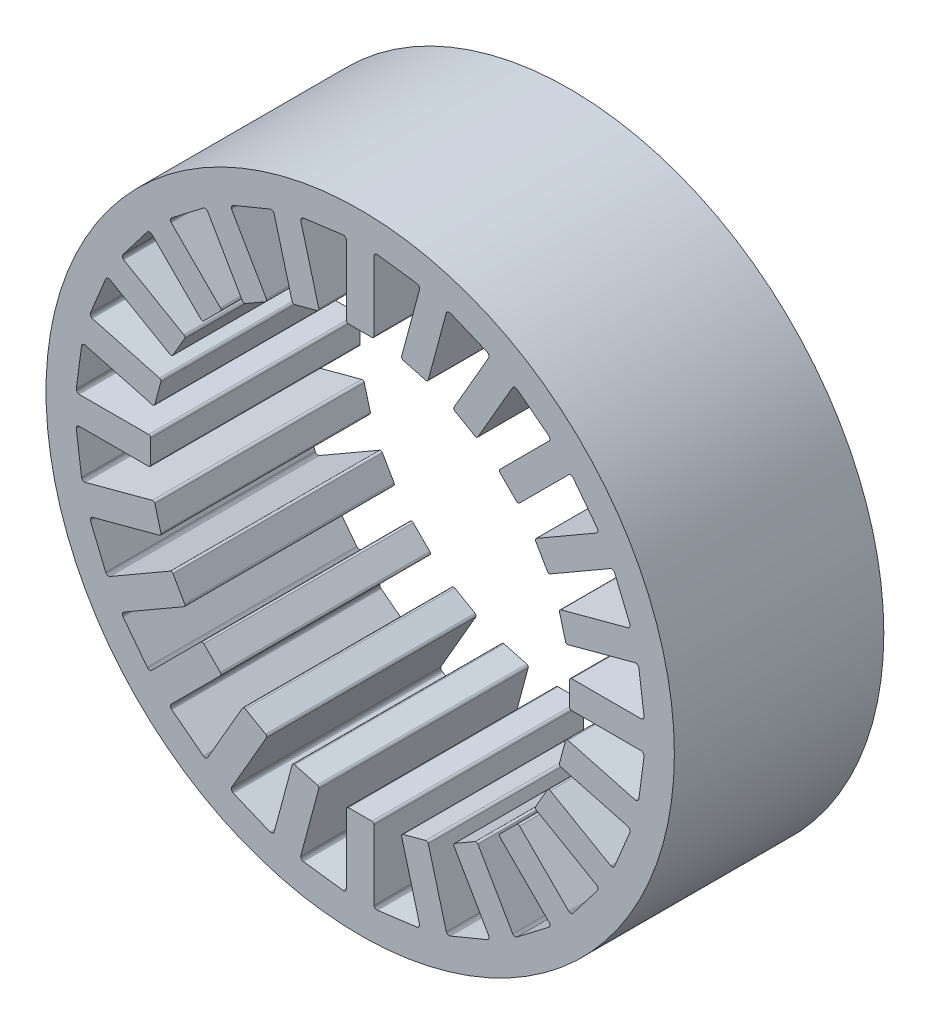
from build123d import *

# Parameters (mm, degrees)
Y_KSEKLIK_EKSTR_ZYON1_DEPTH = 100
Y_KSEKLIK_EKSTR_ZYON2_START = -100
IZIM1_R                     = 148
IZIM1_R_2                   = 145
Y_KSEKLIK_EKSTR_ZYON2_DEPTH = 100
KES_EKSTR_ZYON1_START       = -100
KES_EKSTR_ZYON1_DEPTH       = 100
DAIRESEL_KAPLAMA1_COUNT     = 6
SKETCH1_R                   = 150
SKETCH1_R_2                 = 143.530102486
BOSS_EXTRUDE4_DEPTH         = 100
SKETCH2_R                   = 103.1701
CUT_EXTRUDE1_DEPTH          = 100
BOSS_EXTRUDE8_DEPTH         = 100


with BuildPart() as part:
    # Model → Yükseklik-Ekstrüzyon1 (new body)
    with BuildSketch(Plane.XY):
        with BuildLine():
            ThreePointArc((145, 0), (123.305474643, 76.293904888), (64.713656234, 129.758015925))
            ThreePointArc((64.713656234, 129.758015925), (-123.305474643, -76.293904888), (145, 0))
        make_face()
        with BuildLine():
            Line((60.594545091, 121.498743919), (60.888526886, 121.336265924))
            Line((60.888526886, 121.336265924), (61.138983189, 121.112444487))
            Line((61.138983189, 121.112444487), (61.333355075, 120.838502951))
            Line((61.333355075, 120.838502951), (61.461895925, 120.528177888))
            Line((61.461895925, 120.528177888), (61.518160165, 120.197030291))
            Line((61.518160165, 120.197030291), (61.49932647, 119.861665286))
            Line((61.49932647, 119.861665286), (61.406339241, 119.538899472))
            Line((61.406339241, 119.538899472), (45.772590352, 92.460452083))
            Line((45.772590352, 92.460452083), (42.052500206, 92.377775575))
            Line((42.052500206, 92.377775575), (41.478475057, 90.991956276))
            ThreePointArc((41.478475057, 90.991956276), (50, 86.602540378), (58.062108146, 81.417391248))
            Line((58.062108146, 81.417391248), (58.97525029, 82.607421258))
            Line((58.97525029, 82.607421258), (57.186805174, 85.870452083))
            Line((57.186805174, 85.870452083), (72.820554063, 112.948899472))
            Line((72.820554063, 112.948899472), (73.053583842, 113.190811681))
            Line((73.053583842, 113.190811681), (73.334601609, 113.374804642))
            Line((73.334601609, 113.374804642), (73.64951596, 113.49165218))
            Line((73.64951596, 113.49165218), (73.982535773, 113.53549507))
            Line((73.982535773, 113.53549507), (74.316962046, 113.504134847))
            Line((74.316962046, 113.504134847), (74.636025247, 113.399144045))
            Line((74.636025247, 113.399144045), (74.923726217, 113.225787339))
            Line((74.923726217, 113.225787339), (89.976024918, 101.675752315))
            Line((89.976024918, 101.675752315), (90.217937127, 101.442722535))
            Line((90.217937127, 101.442722535), (90.401930088, 101.161704768))
            Line((90.401930088, 101.161704768), (90.518777625, 100.846790417))
            Line((90.518777625, 100.846790417), (90.562620515, 100.513770604))
            Line((90.562620515, 100.513770604), (90.531260293, 100.179344331))
            Line((90.531260293, 100.179344331), (90.42626949, 99.86028113))
            Line((90.42626949, 99.86028113), (90.252912785, 99.572580161))
            Line((90.252912785, 99.572580161), (68.143453075, 77.463120451))
            Line((68.143453075, 77.463120451), (64.528723672, 78.346091255))
            Line((64.528723672, 78.346091255), (63.615581528, 77.156061245))
            ThreePointArc((63.615581528, 77.156061245), (70.710678119, 70.710678119), (77.156061245, 63.615581528))
            Line((77.156061245, 63.615581528), (78.346091255, 64.528723672))
            Line((78.346091255, 64.528723672), (77.463120451, 68.143453075))
            Line((77.463120451, 68.143453075), (99.572580161, 90.252912785))
            Line((99.572580161, 90.252912785), (99.86028113, 90.42626949))
            Line((99.86028113, 90.42626949), (100.179344331, 90.531260293))
            Line((100.179344331, 90.531260293), (100.513770604, 90.562620515))
            Line((100.513770604, 90.562620515), (100.846790417, 90.518777625))
            Line((100.846790417, 90.518777625), (101.161704768, 90.401930088))
            Line((101.161704768, 90.401930088), (101.442722535, 90.217937127))
            Line((101.442722535, 90.217937127), (101.675752315, 89.976024918))
            Line((101.675752315, 89.976024918), (113.225787339, 74.923726217))
            Line((113.225787339, 74.923726217), (113.399144045, 74.636025247))
            Line((113.399144045, 74.636025247), (113.504134847, 74.316962046))
            Line((113.504134847, 74.316962046), (113.53549507, 73.982535773))
            Line((113.53549507, 73.982535773), (113.49165218, 73.64951596))
            Line((113.49165218, 73.64951596), (113.374804642, 73.334601609))
            Line((113.374804642, 73.334601609), (113.190811681, 73.053583842))
            Line((113.190811681, 73.053583842), (112.948899472, 72.820554063))
            Line((112.948899472, 72.820554063), (85.870452083, 57.186805174))
            Line((85.870452083, 57.186805174), (82.607421258, 58.97525029))
            Line((82.607421258, 58.97525029), (81.417391248, 58.062108146))
            ThreePointArc((81.417391248, 58.062108146), (86.602540378, 50), (90.991956276, 41.478475057))
            Line((90.991956276, 41.478475057), (92.377775575, 42.052500206))
            Line((92.377775575, 42.052500206), (92.460452083, 45.772590352))
            Line((92.460452083, 45.772590352), (119.538899472, 61.406339241))
            Line((119.538899472, 61.406339241), (119.861665286, 61.49932647))
            Line((119.861665286, 61.49932647), (120.197030291, 61.518160165))
            Line((120.197030291, 61.518160165), (120.528177888, 61.461895925))
            Line((120.528177888, 61.461895925), (120.838502951, 61.333355075))
            Line((120.838502951, 61.333355075), (121.112444487, 61.138983189))
            Line((121.112444487, 61.138983189), (121.336265924, 60.888526886))
            Line((121.336265924, 60.888526886), (121.498743919, 60.594545091))
            Line((121.498743919, 60.594545091), (128.759399467, 43.065771994))
            Line((128.759399467, 43.065771994), (128.852386696, 42.743006181))
            Line((128.852386696, 42.743006181), (128.871220391, 42.407641175))
            Line((128.871220391, 42.407641175), (128.814956152, 42.076493579))
            Line((128.814956152, 42.076493579), (128.686415302, 41.766168515))
            Line((128.686415302, 41.766168515), (128.492043416, 41.492226979))
            Line((128.492043416, 41.492226979), (128.241587113, 41.268405542))
            Line((128.241587113, 41.268405542), (127.947605317, 41.105927547))
            Line((127.947605317, 41.105927547), (97.74552169, 33.01330363))
            Line((97.74552169, 33.01330363), (95.056559601, 35.585343478))
            Line((95.056559601, 35.585343478), (93.670740302, 35.01131833))
            ThreePointArc((93.670740302, 35.01131833), (96.592582629, 25.88190451), (98.626899858, 16.514679058))
            Line((98.626899858, 16.514679058), (100.11406715, 16.710468346))
            Line((100.11406715, 16.710468346), (101.156756704, 20.282401239))
            Line((101.156756704, 20.282401239), (131.358840332, 28.375025157))
            Line((131.358840332, 28.375025157), (131.694675033, 28.381305983))
            Line((131.694675033, 28.381305983), (132.023487272, 28.312699085))
            Line((132.023487272, 28.312699085), (132.328789031, 28.172644698))
            Line((132.328789031, 28.172644698), (132.595271204, 27.968165734))
            Line((132.595271204, 27.968165734), (132.809571263, 27.709515623))
            Line((132.809571263, 27.709515623), (132.960943308, 27.409664161))
            Line((132.960943308, 27.409664161), (133.041796912, 27.083647153))
            Line((133.041796912, 27.083647153), (135.518271307, 8.27295658))
            Line((135.518271307, 8.27295658), (135.524552134, 7.937121879))
            Line((135.524552134, 7.937121879), (135.455945235, 7.60830964))
            Line((135.455945235, 7.60830964), (135.315890848, 7.303007881))
            Line((135.315890848, 7.303007881), (135.111411885, 7.036525708))
            Line((135.111411885, 7.036525708), (134.852761774, 6.822225649))
            Line((134.852761774, 6.822225649), (134.552910312, 6.670853604))
            Line((134.552910312, 6.670853604), (134.226893304, 6.59))
            Line((134.226893304, 6.59), (102.959395526, 6.59))
            Line((102.959395526, 6.59), (101.027750496, 9.770354316))
            Line((101.027750496, 9.770354316), (99.540583204, 9.574565028))
            ThreePointArc((99.540583204, 9.574565028), (100, 0), (99.540583204, -9.574565028))
            Line((99.540583204, -9.574565028), (101.027750496, -9.770354316))
            Line((101.027750496, -9.770354316), (102.959395526, -6.59))
            Line((102.959395526, -6.59), (134.226893304, -6.59))
            Line((134.226893304, -6.59), (134.552910312, -6.670853604))
            Line((134.552910312, -6.670853604), (134.852761774, -6.822225649))
            Line((134.852761774, -6.822225649), (135.111411885, -7.036525708))
            Line((135.111411885, -7.036525708), (135.315890848, -7.303007881))
            Line((135.315890848, -7.303007881), (135.455945235, -7.60830964))
            Line((135.455945235, -7.60830964), (135.524552134, -7.937121879))
            Line((135.524552134, -7.937121879), (135.518271307, -8.27295658))
            Line((135.518271307, -8.27295658), (133.041796912, -27.083647153))
            Line((133.041796912, -27.083647153), (132.960943308, -27.409664161))
            Line((132.960943308, -27.409664161), (132.809571263, -27.709515623))
            Line((132.809571263, -27.709515623), (132.595271204, -27.968165734))
            Line((132.595271204, -27.968165734), (132.328789031, -28.172644698))
            Line((132.328789031, -28.172644698), (132.023487272, -28.312699085))
            Line((132.023487272, -28.312699085), (131.694675033, -28.381305983))
            Line((131.694675033, -28.381305983), (131.358840332, -28.375025157))
            Line((131.358840332, -28.375025157), (101.156756704, -20.282401239))
            Line((101.156756704, -20.282401239), (100.11406715, -16.710468346))
            Line((100.11406715, -16.710468346), (98.626899858, -16.514679058))
            ThreePointArc((98.626899858, -16.514679058), (96.592582629, -25.88190451), (93.670740302, -35.01131833))
            Line((93.670740302, -35.01131833), (95.056559601, -35.585343478))
            Line((95.056559601, -35.585343478), (97.74552169, -33.01330363))
            Line((97.74552169, -33.01330363), (127.947605317, -41.105927547))
            Line((127.947605317, -41.105927547), (128.241587113, -41.268405542))
            Line((128.241587113, -41.268405542), (128.492043416, -41.492226979))
            Line((128.492043416, -41.492226979), (128.686415302, -41.766168515))
            Line((128.686415302, -41.766168515), (128.814956152, -42.076493579))
            Line((128.814956152, -42.076493579), (128.871220391, -42.407641175))
            Line((128.871220391, -42.407641175), (128.852386696, -42.743006181))
            Line((128.852386696, -42.743006181), (128.759399467, -43.065771994))
            Line((128.759399467, -43.065771994), (121.498743919, -60.594545091))
            Line((121.498743919, -60.594545091), (121.336265924, -60.888526886))
            Line((121.336265924, -60.888526886), (121.112444487, -61.138983189))
            Line((121.112444487, -61.138983189), (120.838502951, -61.333355075))
            Line((120.838502951, -61.333355075), (120.528177888, -61.461895925))
            Line((120.528177888, -61.461895925), (120.197030291, -61.518160165))
            Line((120.197030291, -61.518160165), (119.861665286, -61.49932647))
            Line((119.861665286, -61.49932647), (119.538899472, -61.406339241))
            Line((119.538899472, -61.406339241), (92.460452083, -45.772590352))
            Line((92.460452083, -45.772590352), (92.377775575, -42.052500206))
            Line((92.377775575, -42.052500206), (90.991956276, -41.478475057))
            ThreePointArc((90.991956276, -41.478475057), (86.602540378, -50), (81.417391248, -58.062108146))
            Line((81.417391248, -58.062108146), (82.607421258, -58.97525029))
            Line((82.607421258, -58.97525029), (85.870452083, -57.186805174))
            Line((85.870452083, -57.186805174), (112.948899472, -72.820554063))
            Line((112.948899472, -72.820554063), (113.190811681, -73.053583842))
            Line((113.190811681, -73.053583842), (113.374804642, -73.334601609))
            Line((113.374804642, -73.334601609), (113.49165218, -73.64951596))
            Line((113.49165218, -73.64951596), (113.53549507, -73.982535773))
            Line((113.53549507, -73.982535773), (113.504134847, -74.316962046))
            Line((113.504134847, -74.316962046), (113.399144045, -74.636025247))
            Line((113.399144045, -74.636025247), (113.225787339, -74.923726217))
            Line((113.225787339, -74.923726217), (101.675752315, -89.976024918))
            Line((101.675752315, -89.976024918), (101.442722535, -90.217937127))
            Line((101.442722535, -90.217937127), (101.161704768, -90.401930088))
            Line((101.161704768, -90.401930088), (100.846790417, -90.518777625))
            Line((100.846790417, -90.518777625), (100.513770604, -90.562620515))
            Line((100.513770604, -90.562620515), (100.179344331, -90.531260293))
            Line((100.179344331, -90.531260293), (99.86028113, -90.42626949))
            Line((99.86028113, -90.42626949), (99.572580161, -90.252912785))
            Line((99.572580161, -90.252912785), (77.463120451, -68.143453075))
            Line((77.463120451, -68.143453075), (78.346091255, -64.528723672))
            Line((78.346091255, -64.528723672), (77.156061245, -63.615581528))
            ThreePointArc((77.156061245, -63.615581528), (70.710678119, -70.710678119), (63.615581528, -77.156061245))
            Line((63.615581528, -77.156061245), (64.528723672, -78.346091255))
            Line((64.528723672, -78.346091255), (68.143453075, -77.463120451))
            Line((68.143453075, -77.463120451), (90.252912785, -99.572580161))
            Line((90.252912785, -99.572580161), (90.42626949, -99.86028113))
            Line((90.42626949, -99.86028113), (90.531260293, -100.179344331))
            Line((90.531260293, -100.179344331), (90.562620515, -100.513770604))
            Line((90.562620515, -100.513770604), (90.518777625, -100.846790417))
            Line((90.518777625, -100.846790417), (90.401930088, -101.161704768))
            Line((90.401930088, -101.161704768), (90.217937127, -101.442722535))
            Line((90.217937127, -101.442722535), (89.976024918, -101.675752315))
            Line((89.976024918, -101.675752315), (74.923726217, -113.225787339))
            Line((74.923726217, -113.225787339), (74.636025247, -113.399144045))
            Line((74.636025247, -113.399144045), (74.316962046, -113.504134847))
            Line((74.316962046, -113.504134847), (73.982535773, -113.53549507))
            Line((73.982535773, -113.53549507), (73.64951596, -113.49165218))
            Line((73.64951596, -113.49165218), (73.334601609, -113.374804642))
            Line((73.334601609, -113.374804642), (73.053583842, -113.190811681))
            Line((73.053583842, -113.190811681), (72.820554063, -112.948899472))
            Line((72.820554063, -112.948899472), (57.186805174, -85.870452083))
            Line((57.186805174, -85.870452083), (58.97525029, -82.607421258))
            Line((58.97525029, -82.607421258), (58.062108146, -81.417391248))
            ThreePointArc((58.062108146, -81.417391248), (50, -86.602540378), (41.478475057, -90.991956276))
            Line((41.478475057, -90.991956276), (42.052500206, -92.377775575))
            Line((42.052500206, -92.377775575), (45.772590352, -92.460452083))
            Line((45.772590352, -92.460452083), (61.406339241, -119.538899472))
            Line((61.406339241, -119.538899472), (61.49932647, -119.861665286))
            Line((61.49932647, -119.861665286), (61.518160165, -120.197030291))
            Line((61.518160165, -120.197030291), (61.461895925, -120.528177888))
            Line((61.461895925, -120.528177888), (61.333355075, -120.838502951))
            Line((61.333355075, -120.838502951), (61.138983189, -121.112444487))
            Line((61.138983189, -121.112444487), (60.888526886, -121.336265924))
            Line((60.888526886, -121.336265924), (60.594545091, -121.498743919))
            Line((60.594545091, -121.498743919), (43.065771994, -128.759399467))
            Line((43.065771994, -128.759399467), (42.743006181, -128.852386696))
            Line((42.743006181, -128.852386696), (42.407641175, -128.871220391))
            Line((42.407641175, -128.871220391), (42.076493579, -128.814956152))
            Line((42.076493579, -128.814956152), (41.766168515, -128.686415302))
            Line((41.766168515, -128.686415302), (41.492226979, -128.492043416))
            Line((41.492226979, -128.492043416), (41.268405542, -128.241587113))
            Line((41.268405542, -128.241587113), (41.105927547, -127.947605317))
            Line((41.105927547, -127.947605317), (33.01330363, -97.74552169))
            Line((33.01330363, -97.74552169), (35.585343478, -95.056559601))
            Line((35.585343478, -95.056559601), (35.01131833, -93.670740302))
            ThreePointArc((35.01131833, -93.670740302), (25.88190451, -96.592582629), (16.514679058, -98.626899858))
            Line((16.514679058, -98.626899858), (16.710468346, -100.11406715))
            Line((16.710468346, -100.11406715), (20.282401239, -101.156756704))
            Line((20.282401239, -101.156756704), (28.375025157, -131.358840332))
            Line((28.375025157, -131.358840332), (28.381305983, -131.694675033))
            Line((28.381305983, -131.694675033), (28.312699085, -132.023487272))
            Line((28.312699085, -132.023487272), (28.172644698, -132.328789031))
            Line((28.172644698, -132.328789031), (27.968165734, -132.595271204))
            Line((27.968165734, -132.595271204), (27.709515623, -132.809571263))
            Line((27.709515623, -132.809571263), (27.409664161, -132.960943308))
            Line((27.409664161, -132.960943308), (27.083647153, -133.041796912))
            Line((27.083647153, -133.041796912), (8.27295658, -135.518271307))
            Line((8.27295658, -135.518271307), (7.937121879, -135.524552134))
            Line((7.937121879, -135.524552134), (7.60830964, -135.455945235))
            Line((7.60830964, -135.455945235), (7.303007881, -135.315890848))
            Line((7.303007881, -135.315890848), (7.036525708, -135.111411885))
            Line((7.036525708, -135.111411885), (6.822225649, -134.852761774))
            Line((6.822225649, -134.852761774), (6.670853604, -134.552910312))
            Line((6.670853604, -134.552910312), (6.59, -134.226893304))
            Line((6.59, -134.226893304), (6.59, -102.959395526))
            Line((6.59, -102.959395526), (9.770354316, -101.027750496))
            Line((9.770354316, -101.027750496), (9.574565028, -99.540583204))
            ThreePointArc((9.574565028, -99.540583204), (0, -100), (-9.574565028, -99.540583204))
            Line((-9.574565028, -99.540583204), (-9.770354316, -101.027750496))
            Line((-9.770354316, -101.027750496), (-6.59, -102.959395526))
            Line((-6.59, -102.959395526), (-6.59, -134.226893304))
            Line((-6.59, -134.226893304), (-6.670853604, -134.552910312))
            Line((-6.670853604, -134.552910312), (-6.822225649, -134.852761774))
            Line((-6.822225649, -134.852761774), (-7.036525708, -135.111411885))
            Line((-7.036525708, -135.111411885), (-7.303007881, -135.315890848))
            Line((-7.303007881, -135.315890848), (-7.60830964, -135.455945235))
            Line((-7.60830964, -135.455945235), (-7.937121879, -135.524552134))
            Line((-7.937121879, -135.524552134), (-8.27295658, -135.518271307))
            Line((-8.27295658, -135.518271307), (-27.083647153, -133.041796912))
            Line((-27.083647153, -133.041796912), (-27.409664161, -132.960943308))
            Line((-27.409664161, -132.960943308), (-27.709515623, -132.809571263))
            Line((-27.709515623, -132.809571263), (-27.968165734, -132.595271204))
            Line((-27.968165734, -132.595271204), (-28.172644698, -132.328789031))
            Line((-28.172644698, -132.328789031), (-28.312699085, -132.023487272))
            Line((-28.312699085, -132.023487272), (-28.381305983, -131.694675033))
            Line((-28.381305983, -131.694675033), (-28.375025157, -131.358840332))
            Line((-28.375025157, -131.358840332), (-20.282401239, -101.156756704))
            Line((-20.282401239, -101.156756704), (-16.710468346, -100.11406715))
            Line((-16.710468346, -100.11406715), (-16.514679058, -98.626899858))
            ThreePointArc((-16.514679058, -98.626899858), (-25.88190451, -96.592582629), (-35.01131833, -93.670740302))
            Line((-35.01131833, -93.670740302), (-35.585343478, -95.056559601))
            Line((-35.585343478, -95.056559601), (-33.01330363, -97.74552169))
            Line((-33.01330363, -97.74552169), (-41.105927547, -127.947605317))
            Line((-41.105927547, -127.947605317), (-41.268405542, -128.241587113))
            Line((-41.268405542, -128.241587113), (-41.492226979, -128.492043416))
            Line((-41.492226979, -128.492043416), (-41.766168515, -128.686415302))
            Line((-41.766168515, -128.686415302), (-42.076493579, -128.814956152))
            Line((-42.076493579, -128.814956152), (-42.407641175, -128.871220391))
            Line((-42.407641175, -128.871220391), (-42.743006181, -128.852386696))
            Line((-42.743006181, -128.852386696), (-43.065771994, -128.759399467))
            Line((-43.065771994, -128.759399467), (-60.594545091, -121.498743919))
            Line((-60.594545091, -121.498743919), (-60.888526886, -121.336265924))
            Line((-60.888526886, -121.336265924), (-61.138983189, -121.112444487))
            Line((-61.138983189, -121.112444487), (-61.333355075, -120.838502951))
            Line((-61.333355075, -120.838502951), (-61.461895925, -120.528177888))
            Line((-61.461895925, -120.528177888), (-61.518160165, -120.197030291))
            Line((-61.518160165, -120.197030291), (-61.49932647, -119.861665286))
            Line((-61.49932647, -119.861665286), (-61.406339241, -119.538899472))
            Line((-61.406339241, -119.538899472), (-45.772590352, -92.460452083))
            Line((-45.772590352, -92.460452083), (-42.052500206, -92.377775575))
            Line((-42.052500206, -92.377775575), (-41.478475057, -90.991956276))
            ThreePointArc((-41.478475057, -90.991956276), (-50, -86.602540378), (-58.062108146, -81.417391248))
            Line((-58.062108146, -81.417391248), (-58.97525029, -82.607421258))
            Line((-58.97525029, -82.607421258), (-57.186805174, -85.870452083))
            Line((-57.186805174, -85.870452083), (-72.820554063, -112.948899472))
            Line((-72.820554063, -112.948899472), (-73.053583842, -113.190811681))
            Line((-73.053583842, -113.190811681), (-73.334601609, -113.374804642))
            Line((-73.334601609, -113.374804642), (-73.64951596, -113.49165218))
            Line((-73.64951596, -113.49165218), (-73.982535773, -113.53549507))
            Line((-73.982535773, -113.53549507), (-74.316962046, -113.504134847))
            Line((-74.316962046, -113.504134847), (-74.636025247, -113.399144045))
            Line((-74.636025247, -113.399144045), (-74.923726217, -113.225787339))
            Line((-74.923726217, -113.225787339), (-89.976024918, -101.675752315))
            Line((-89.976024918, -101.675752315), (-90.217937127, -101.442722535))
            Line((-90.217937127, -101.442722535), (-90.401930088, -101.161704768))
            Line((-90.401930088, -101.161704768), (-90.518777625, -100.846790417))
            Line((-90.518777625, -100.846790417), (-90.562620515, -100.513770604))
            Line((-90.562620515, -100.513770604), (-90.531260293, -100.179344331))
            Line((-90.531260293, -100.179344331), (-90.42626949, -99.86028113))
            Line((-90.42626949, -99.86028113), (-90.252912785, -99.572580161))
            Line((-90.252912785, -99.572580161), (-68.143453075, -77.463120451))
            Line((-68.143453075, -77.463120451), (-64.528723672, -78.346091255))
            Line((-64.528723672, -78.346091255), (-63.615581528, -77.156061245))
            ThreePointArc((-63.615581528, -77.156061245), (-70.710678119, -70.710678119), (-77.156061245, -63.615581528))
            Line((-77.156061245, -63.615581528), (-78.346091255, -64.528723672))
            Line((-78.346091255, -64.528723672), (-77.463120451, -68.143453075))
            Line((-77.463120451, -68.143453075), (-99.572580161, -90.252912785))
            Line((-99.572580161, -90.252912785), (-99.86028113, -90.42626949))
            Line((-99.86028113, -90.42626949), (-100.179344331, -90.531260293))
            Line((-100.179344331, -90.531260293), (-100.513770604, -90.562620515))
            Line((-100.513770604, -90.562620515), (-100.846790417, -90.518777625))
            Line((-100.846790417, -90.518777625), (-101.161704768, -90.401930088))
            Line((-101.161704768, -90.401930088), (-101.442722535, -90.217937127))
            Line((-101.442722535, -90.217937127), (-101.675752315, -89.976024918))
            Line((-101.675752315, -89.976024918), (-113.225787339, -74.923726217))
            Line((-113.225787339, -74.923726217), (-113.399144045, -74.636025247))
            Line((-113.399144045, -74.636025247), (-113.504134847, -74.316962046))
            Line((-113.504134847, -74.316962046), (-113.53549507, -73.982535773))
            Line((-113.53549507, -73.982535773), (-113.49165218, -73.64951596))
            Line((-113.49165218, -73.64951596), (-113.374804642, -73.334601609))
            Line((-113.374804642, -73.334601609), (-113.190811681, -73.053583842))
            Line((-113.190811681, -73.053583842), (-112.948899472, -72.820554063))
            Line((-112.948899472, -72.820554063), (-85.870452083, -57.186805174))
            Line((-85.870452083, -57.186805174), (-82.607421258, -58.97525029))
            Line((-82.607421258, -58.97525029), (-81.417391248, -58.062108146))
            ThreePointArc((-81.417391248, -58.062108146), (-86.602540378, -50), (-90.991956276, -41.478475057))
            Line((-90.991956276, -41.478475057), (-92.377775575, -42.052500206))
            Line((-92.377775575, -42.052500206), (-92.460452083, -45.772590352))
            Line((-92.460452083, -45.772590352), (-119.538899472, -61.406339241))
            Line((-119.538899472, -61.406339241), (-119.861665286, -61.49932647))
            Line((-119.861665286, -61.49932647), (-120.197030291, -61.518160165))
            Line((-120.197030291, -61.518160165), (-120.528177888, -61.461895925))
            Line((-120.528177888, -61.461895925), (-120.838502951, -61.333355075))
            Line((-120.838502951, -61.333355075), (-121.112444487, -61.138983189))
            Line((-121.112444487, -61.138983189), (-121.336265924, -60.888526886))
            Line((-121.336265924, -60.888526886), (-121.498743919, -60.594545091))
            Line((-121.498743919, -60.594545091), (-128.759399467, -43.065771994))
            Line((-128.759399467, -43.065771994), (-128.852386696, -42.743006181))
            Line((-128.852386696, -42.743006181), (-128.871220391, -42.407641175))
            Line((-128.871220391, -42.407641175), (-128.814956152, -42.076493579))
            Line((-128.814956152, -42.076493579), (-128.686415302, -41.766168515))
            Line((-128.686415302, -41.766168515), (-128.492043416, -41.492226979))
            Line((-128.492043416, -41.492226979), (-128.241587113, -41.268405542))
            Line((-128.241587113, -41.268405542), (-127.947605317, -41.105927547))
            Line((-127.947605317, -41.105927547), (-97.74552169, -33.01330363))
            Line((-97.74552169, -33.01330363), (-95.056559601, -35.585343478))
            Line((-95.056559601, -35.585343478), (-93.670740302, -35.01131833))
            ThreePointArc((-93.670740302, -35.01131833), (-96.592582629, -25.88190451), (-98.626899858, -16.514679058))
            Line((-98.626899858, -16.514679058), (-100.11406715, -16.710468346))
            Line((-100.11406715, -16.710468346), (-101.156756704, -20.282401239))
            Line((-101.156756704, -20.282401239), (-131.358840332, -28.375025157))
            Line((-131.358840332, -28.375025157), (-131.694675033, -28.381305983))
            Line((-131.694675033, -28.381305983), (-132.023487272, -28.312699085))
            Line((-132.023487272, -28.312699085), (-132.328789031, -28.172644698))
            Line((-132.328789031, -28.172644698), (-132.595271204, -27.968165734))
            Line((-132.595271204, -27.968165734), (-132.809571263, -27.709515623))
            Line((-132.809571263, -27.709515623), (-132.960943308, -27.409664161))
            Line((-132.960943308, -27.409664161), (-133.041796912, -27.083647153))
            Line((-133.041796912, -27.083647153), (-135.518271307, -8.27295658))
            Line((-135.518271307, -8.27295658), (-135.524552134, -7.937121879))
            Line((-135.524552134, -7.937121879), (-135.455945235, -7.60830964))
            Line((-135.455945235, -7.60830964), (-135.315890848, -7.303007881))
            Line((-135.315890848, -7.303007881), (-135.111411885, -7.036525708))
            Line((-135.111411885, -7.036525708), (-134.852761774, -6.822225649))
            Line((-134.852761774, -6.822225649), (-134.552910312, -6.670853604))
            Line((-134.552910312, -6.670853604), (-134.226893304, -6.59))
            Line((-134.226893304, -6.59), (-102.959395526, -6.59))
            Line((-102.959395526, -6.59), (-101.027750496, -9.770354316))
            Line((-101.027750496, -9.770354316), (-99.540583204, -9.574565028))
            ThreePointArc((-99.540583204, -9.574565028), (-100, 0), (-99.540583204, 9.574565028))
            Line((-99.540583204, 9.574565028), (-101.027750496, 9.770354316))
            Line((-101.027750496, 9.770354316), (-102.959395526, 6.59))
            Line((-102.959395526, 6.59), (-134.226893304, 6.59))
            Line((-134.226893304, 6.59), (-134.552910312, 6.670853604))
            Line((-134.552910312, 6.670853604), (-134.852761774, 6.822225649))
            Line((-134.852761774, 6.822225649), (-135.111411885, 7.036525708))
            Line((-135.111411885, 7.036525708), (-135.315890848, 7.303007881))
            Line((-135.315890848, 7.303007881), (-135.455945235, 7.60830964))
            Line((-135.455945235, 7.60830964), (-135.524552134, 7.937121879))
            Line((-135.524552134, 7.937121879), (-135.518271307, 8.27295658))
            Line((-135.518271307, 8.27295658), (-133.041796912, 27.083647153))
            Line((-133.041796912, 27.083647153), (-132.960943308, 27.409664161))
            Line((-132.960943308, 27.409664161), (-132.809571263, 27.709515623))
            Line((-132.809571263, 27.709515623), (-132.595271204, 27.968165734))
            Line((-132.595271204, 27.968165734), (-132.328789031, 28.172644698))
            Line((-132.328789031, 28.172644698), (-132.023487272, 28.312699085))
            Line((-132.023487272, 28.312699085), (-131.694675033, 28.381305983))
            Line((-131.694675033, 28.381305983), (-131.358840332, 28.375025157))
            Line((-131.358840332, 28.375025157), (-101.156756704, 20.282401239))
            Line((-101.156756704, 20.282401239), (-100.11406715, 16.710468346))
            Line((-100.11406715, 16.710468346), (-98.626899858, 16.514679058))
            ThreePointArc((-98.626899858, 16.514679058), (-96.592582629, 25.88190451), (-93.670740302, 35.01131833))
            Line((-93.670740302, 35.01131833), (-95.056559601, 35.585343478))
            Line((-95.056559601, 35.585343478), (-97.74552169, 33.01330363))
            Line((-97.74552169, 33.01330363), (-127.947605317, 41.105927547))
            Line((-127.947605317, 41.105927547), (-128.241587113, 41.268405542))
            Line((-128.241587113, 41.268405542), (-128.492043416, 41.492226979))
            Line((-128.492043416, 41.492226979), (-128.686415302, 41.766168515))
            Line((-128.686415302, 41.766168515), (-128.814956152, 42.076493579))
            Line((-128.814956152, 42.076493579), (-128.871220391, 42.407641175))
            Line((-128.871220391, 42.407641175), (-128.852386696, 42.743006181))
            Line((-128.852386696, 42.743006181), (-128.759399467, 43.065771994))
            Line((-128.759399467, 43.065771994), (-121.498743919, 60.594545091))
            Line((-121.498743919, 60.594545091), (-121.336265924, 60.888526886))
            Line((-121.336265924, 60.888526886), (-121.112444487, 61.138983189))
            Line((-121.112444487, 61.138983189), (-120.838502951, 61.333355075))
            Line((-120.838502951, 61.333355075), (-120.528177888, 61.461895925))
            Line((-120.528177888, 61.461895925), (-120.197030291, 61.518160165))
            Line((-120.197030291, 61.518160165), (-119.861665286, 61.49932647))
            Line((-119.861665286, 61.49932647), (-119.538899472, 61.406339241))
            Line((-119.538899472, 61.406339241), (-92.460452083, 45.772590352))
            Line((-92.460452083, 45.772590352), (-92.377775575, 42.052500206))
            Line((-92.377775575, 42.052500206), (-90.991956276, 41.478475057))
            ThreePointArc((-90.991956276, 41.478475057), (-86.602540378, 50), (-81.417391248, 58.062108146))
            Line((-81.417391248, 58.062108146), (-82.607421258, 58.97525029))
            Line((-82.607421258, 58.97525029), (-85.870452083, 57.186805174))
            Line((-85.870452083, 57.186805174), (-112.948899472, 72.820554063))
            Line((-112.948899472, 72.820554063), (-113.190811681, 73.053583842))
            Line((-113.190811681, 73.053583842), (-113.374804642, 73.334601609))
            Line((-113.374804642, 73.334601609), (-113.49165218, 73.64951596))
            Line((-113.49165218, 73.64951596), (-113.53549507, 73.982535773))
            Line((-113.53549507, 73.982535773), (-113.504134847, 74.316962046))
            Line((-113.504134847, 74.316962046), (-113.399144045, 74.636025247))
            Line((-113.399144045, 74.636025247), (-113.225787339, 74.923726217))
            Line((-113.225787339, 74.923726217), (-101.675752315, 89.976024918))
            Line((-101.675752315, 89.976024918), (-101.442722535, 90.217937127))
            Line((-101.442722535, 90.217937127), (-101.161704768, 90.401930088))
            Line((-101.161704768, 90.401930088), (-100.846790417, 90.518777625))
            Line((-100.846790417, 90.518777625), (-100.513770604, 90.562620515))
            Line((-100.513770604, 90.562620515), (-100.179344331, 90.531260293))
            Line((-100.179344331, 90.531260293), (-99.86028113, 90.42626949))
            Line((-99.86028113, 90.42626949), (-99.572580161, 90.252912785))
            Line((-99.572580161, 90.252912785), (-77.463120451, 68.143453075))
            Line((-77.463120451, 68.143453075), (-78.346091255, 64.528723672))
            Line((-78.346091255, 64.528723672), (-77.156061245, 63.615581528))
            ThreePointArc((-77.156061245, 63.615581528), (-70.710678119, 70.710678119), (-63.615581528, 77.156061245))
            Line((-63.615581528, 77.156061245), (-64.528723672, 78.346091255))
            Line((-64.528723672, 78.346091255), (-68.143453075, 77.463120451))
            Line((-68.143453075, 77.463120451), (-90.252912785, 99.572580161))
            Line((-90.252912785, 99.572580161), (-90.42626949, 99.86028113))
            Line((-90.42626949, 99.86028113), (-90.531260293, 100.179344331))
            Line((-90.531260293, 100.179344331), (-90.562620515, 100.513770604))
            Line((-90.562620515, 100.513770604), (-90.518777625, 100.846790417))
            Line((-90.518777625, 100.846790417), (-90.401930088, 101.161704768))
            Line((-90.401930088, 101.161704768), (-90.217937127, 101.442722535))
            Line((-90.217937127, 101.442722535), (-89.976024918, 101.675752315))
            Line((-89.976024918, 101.675752315), (-74.923726217, 113.225787339))
            Line((-74.923726217, 113.225787339), (-74.636025247, 113.399144045))
            Line((-74.636025247, 113.399144045), (-74.316962046, 113.504134847))
            Line((-74.316962046, 113.504134847), (-73.982535773, 113.53549507))
            Line((-73.982535773, 113.53549507), (-73.64951596, 113.49165218))
            Line((-73.64951596, 113.49165218), (-73.334601609, 113.374804642))
            Line((-73.334601609, 113.374804642), (-73.053583842, 113.190811681))
            Line((-73.053583842, 113.190811681), (-72.820554063, 112.948899472))
            Line((-72.820554063, 112.948899472), (-57.186805174, 85.870452083))
            Line((-57.186805174, 85.870452083), (-58.97525029, 82.607421258))
            Line((-58.97525029, 82.607421258), (-58.062108146, 81.417391248))
            ThreePointArc((-58.062108146, 81.417391248), (-50, 86.602540378), (-41.478475057, 90.991956276))
            Line((-41.478475057, 90.991956276), (-42.052500206, 92.377775575))
            Line((-42.052500206, 92.377775575), (-45.772590352, 92.460452083))
            Line((-45.772590352, 92.460452083), (-61.406339241, 119.538899472))
            Line((-61.406339241, 119.538899472), (-61.49932647, 119.861665286))
            Line((-61.49932647, 119.861665286), (-61.518160165, 120.197030291))
            Line((-61.518160165, 120.197030291), (-61.461895925, 120.528177888))
            Line((-61.461895925, 120.528177888), (-61.333355075, 120.838502951))
            Line((-61.333355075, 120.838502951), (-61.138983189, 121.112444487))
            Line((-61.138983189, 121.112444487), (-60.888526886, 121.336265924))
            Line((-60.888526886, 121.336265924), (-60.594545091, 121.498743919))
            Line((-60.594545091, 121.498743919), (-43.065771994, 128.759399467))
            Line((-43.065771994, 128.759399467), (-42.743006181, 128.852386696))
            Line((-42.743006181, 128.852386696), (-42.407641175, 128.871220391))
            Line((-42.407641175, 128.871220391), (-42.076493579, 128.814956152))
            Line((-42.076493579, 128.814956152), (-41.766168515, 128.686415302))
            Line((-41.766168515, 128.686415302), (-41.492226979, 128.492043416))
            Line((-41.492226979, 128.492043416), (-41.268405542, 128.241587113))
            Line((-41.268405542, 128.241587113), (-41.105927547, 127.947605317))
            Line((-41.105927547, 127.947605317), (-33.01330363, 97.74552169))
            Line((-33.01330363, 97.74552169), (-35.585343478, 95.056559601))
            Line((-35.585343478, 95.056559601), (-35.01131833, 93.670740302))
            ThreePointArc((-35.01131833, 93.670740302), (-25.88190451, 96.592582629), (-16.514679058, 98.626899858))
            Line((-16.514679058, 98.626899858), (-16.710468346, 100.11406715))
            Line((-16.710468346, 100.11406715), (-20.282401239, 101.156756704))
            Line((-20.282401239, 101.156756704), (-28.375025157, 131.358840332))
            Line((-28.375025157, 131.358840332), (-28.381305983, 131.694675033))
            Line((-28.381305983, 131.694675033), (-28.312699085, 132.023487272))
            Line((-28.312699085, 132.023487272), (-28.172644698, 132.328789031))
            Line((-28.172644698, 132.328789031), (-27.968165734, 132.595271204))
            Line((-27.968165734, 132.595271204), (-27.709515623, 132.809571263))
            Line((-27.709515623, 132.809571263), (-27.409664161, 132.960943308))
            Line((-27.409664161, 132.960943308), (-27.083647153, 133.041796912))
            Line((-27.083647153, 133.041796912), (-8.27295658, 135.518271307))
            Line((-8.27295658, 135.518271307), (-7.937121879, 135.524552134))
            Line((-7.937121879, 135.524552134), (-7.60830964, 135.455945235))
            Line((-7.60830964, 135.455945235), (-7.303007881, 135.315890848))
            Line((-7.303007881, 135.315890848), (-7.036525708, 135.111411885))
            Line((-7.036525708, 135.111411885), (-6.822225649, 134.852761774))
            Line((-6.822225649, 134.852761774), (-6.670853604, 134.552910312))
            Line((-6.670853604, 134.552910312), (-6.59, 134.226893304))
            Line((-6.59, 134.226893304), (-6.59, 102.959395526))
            Line((-6.59, 102.959395526), (-9.770354316, 101.027750496))
            Line((-9.770354316, 101.027750496), (-9.574565028, 99.540583204))
            ThreePointArc((-9.574565028, 99.540583204), (0, 100), (9.574565028, 99.540583204))
            Line((9.574565028, 99.540583204), (9.770354316, 101.027750496))
            Line((9.770354316, 101.027750496), (6.59, 102.959395526))
            Line((6.59, 102.959395526), (6.59, 134.226893304))
            Line((6.59, 134.226893304), (6.670853604, 134.552910312))
            Line((6.670853604, 134.552910312), (6.822225649, 134.852761774))
            Line((6.822225649, 134.852761774), (7.036525708, 135.111411885))
            Line((7.036525708, 135.111411885), (7.303007881, 135.315890848))
            Line((7.303007881, 135.315890848), (7.60830964, 135.455945235))
            Line((7.60830964, 135.455945235), (7.937121879, 135.524552134))
            Line((7.937121879, 135.524552134), (8.27295658, 135.518271307))
            Line((8.27295658, 135.518271307), (27.083647153, 133.041796912))
            Line((27.083647153, 133.041796912), (27.409664161, 132.960943308))
            Line((27.409664161, 132.960943308), (27.709515623, 132.809571263))
            Line((27.709515623, 132.809571263), (27.968165734, 132.595271204))
            Line((27.968165734, 132.595271204), (28.172644698, 132.328789031))
            Line((28.172644698, 132.328789031), (28.312699085, 132.023487272))
            Line((28.312699085, 132.023487272), (28.381305983, 131.694675033))
            Line((28.381305983, 131.694675033), (28.375025157, 131.358840332))
            Line((28.375025157, 131.358840332), (20.282401239, 101.156756704))
            Line((20.282401239, 101.156756704), (16.710468346, 100.11406715))
            Line((16.710468346, 100.11406715), (16.514679058, 98.626899858))
            ThreePointArc((16.514679058, 98.626899858), (25.88190451, 96.592582629), (35.01131833, 93.670740302))
            Line((35.01131833, 93.670740302), (35.585343478, 95.056559601))
            Line((35.585343478, 95.056559601), (33.01330363, 97.74552169))
            Line((33.01330363, 97.74552169), (41.105927547, 127.947605317))
            Line((41.105927547, 127.947605317), (41.268405542, 128.241587113))
            Line((41.268405542, 128.241587113), (41.492226979, 128.492043416))
            Line((41.492226979, 128.492043416), (41.766168515, 128.686415302))
            Line((41.766168515, 128.686415302), (42.076493579, 128.814956152))
            Line((42.076493579, 128.814956152), (42.407641175, 128.871220391))
            Line((42.407641175, 128.871220391), (42.743006181, 128.852386696))
            Line((42.743006181, 128.852386696), (43.065771994, 128.759399467))
            Line((43.065771994, 128.759399467), (60.594545091, 121.498743919))
        make_face(mode=Mode.SUBTRACT)
    extrude(amount=Y_KSEKLIK_EKSTR_ZYON1_DEPTH)

    # Çizim1 → Yükseklik-Ekstrüzyon2 (add)
    with BuildSketch(Plane.XY.offset(100).offset(Y_KSEKLIK_EKSTR_ZYON2_START)):
        Circle(IZIM1_R)
        Circle(IZIM1_R_2, mode=Mode.SUBTRACT)
    extrude(amount=Y_KSEKLIK_EKSTR_ZYON2_DEPTH)

    # Çizim2 → Kes-Ekstrüzyon1 (cut)
    with BuildSketch(Plane.XY.offset(100).offset(KES_EKSTR_ZYON1_START)):
        with BuildLine():
            ThreePointArc((-3.95971114, 147.947019868), (0, 146), (3.95971114, 147.947019868))
            ThreePointArc((3.95971114, 147.947019868), (0, 148), (-3.95971114, 147.947019868))
        make_face()
    kes_ekstr_zyon1 = extrude(amount=KES_EKSTR_ZYON1_DEPTH, mode=Mode.SUBTRACT)

    # Dairesel Kaplama1: Kes-Ekstrüzyon1 ×6 about axis
    dairesel_kaplama1_axis = Axis((0, 0, 0), (0, 0, 1))
    for i in range(1, DAIRESEL_KAPLAMA1_COUNT):
        add(kes_ekstr_zyon1.rotate(dairesel_kaplama1_axis, i * 360 / DAIRESEL_KAPLAMA1_COUNT), mode=Mode.SUBTRACT)

    # Sketch1 → Boss-Extrude4 (add)
    with BuildSketch(Plane.XY.offset(100)):
        Circle(SKETCH1_R)
        with Locations((1.990863061, 0)):
            Circle(SKETCH1_R_2, mode=Mode.SUBTRACT)
    extrude(amount=-BOSS_EXTRUDE4_DEPTH)

    # Sketch2 → Cut-Extrude1 (cut)
    with BuildSketch(Plane.XY.offset(100)):
        Circle(SKETCH2_R)
    extrude(amount=-CUT_EXTRUDE1_DEPTH, mode=Mode.SUBTRACT)

    # Sketch4 → Boss-Extrude8 (add)
    with BuildSketch(Plane.XY.offset(100)):
        with BuildLine():
            Line((21.157417825, 104.42236306), (19.77527236, 99.264125962))
            ThreePointArc((19.77527236, 99.264125962), (19.875172783, 98.505306917), (20.482379141, 98.039381091))
            Line((20.482379141, 98.039381091), (31.281429879, 95.145784167))
            ThreePointArc((31.281429879, 95.145784167), (32.040248924, 95.245684589), (32.506174751, 95.852890948))
            Line((32.506174751, 95.852890948), (33.888320215, 101.011128046))
            Line((33.888320215, 101.011128046), (21.157417825, 104.42236306))
        make_face()
        with BuildLine():
            Line((-6.59, 106.3402), (6.59, 106.3402))
            Line((6.59, 106.3402), (6.59, 101))
            ThreePointArc((6.59, 101), (6.297106781, 100.292893219), (5.59, 100))
            Line((5.59, 100), (-5.59, 100))
            ThreePointArc((-5.59, 100), (-6.297106781, 100.292893219), (-6.59, 101))
            Line((-6.59, 101), (-6.59, 106.3402))
        make_face()
        with BuildLine():
            Line((47.462992589, 95.388314644), (44.792892589, 90.763565782))
            ThreePointArc((44.792892589, 90.763565782), (44.692992167, 90.004746737), (45.158917993, 89.397540378))
            Line((45.158917993, 89.397540378), (54.841082007, 83.807540378))
            ThreePointArc((54.841082007, 83.807540378), (55.599901052, 83.707639956), (56.207107411, 84.173565782))
            Line((56.207107411, 84.173565782), (58.877207411, 88.798314644))
            Line((58.877207411, 88.798314644), (47.462992589, 95.388314644))
        make_face()
        with BuildLine():
            Line((70.534042845, 79.853710221), (66.757951212, 76.077618588))
            ThreePointArc((66.757951212, 76.077618588), (66.465057993, 75.370511807), (66.757951212, 74.663405025))
            Line((66.757951212, 74.663405025), (74.663405025, 66.757951212))
            ThreePointArc((74.663405025, 66.757951212), (75.370511807, 66.465057993), (76.077618588, 66.757951212))
            Line((76.077618588, 66.757951212), (79.853710221, 70.534042845))
            Line((79.853710221, 70.534042845), (70.534042845, 79.853710221))
        make_face()
        with BuildLine():
            Line((88.798314644, 58.877207411), (84.173565782, 56.207107411))
            ThreePointArc((84.173565782, 56.207107411), (83.707639956, 55.599901052), (83.807540378, 54.841082007))
            Line((83.807540378, 54.841082007), (89.397540378, 45.158917993))
            ThreePointArc((89.397540378, 45.158917993), (90.004746737, 44.692992167), (90.763565782, 44.792892589))
            Line((90.763565782, 44.792892589), (95.388314644, 47.462992589))
            Line((95.388314644, 47.462992589), (88.798314644, 58.877207411))
        make_face()
        with BuildLine():
            Line((101.011128046, 33.888320215), (95.852890948, 32.506174751))
            ThreePointArc((95.852890948, 32.506174751), (95.245684589, 32.040248924), (95.145784167, 31.281429879))
            Line((95.145784167, 31.281429879), (98.039381091, 20.482379141))
            ThreePointArc((98.039381091, 20.482379141), (98.505306917, 19.875172783), (99.264125962, 19.77527236))
            Line((99.264125962, 19.77527236), (104.42236306, 21.157417825))
            Line((104.42236306, 21.157417825), (101.011128046, 33.888320215))
        make_face()
        with BuildLine():
            Line((106.3402, 6.59), (101, 6.59))
            ThreePointArc((101, 6.59), (100.292893219, 6.297106781), (100, 5.59))
            Line((100, 5.59), (100, -5.59))
            ThreePointArc((100, -5.59), (100.292893219, -6.297106781), (101, -6.59))
            Line((101, -6.59), (106.3402, -6.59))
            Line((106.3402, -6.59), (106.3402, 6.59))
        make_face()
        with BuildLine():
            Line((104.42236306, -21.157417825), (99.264125962, -19.77527236))
            ThreePointArc((99.264125962, -19.77527236), (98.505306917, -19.875172783), (98.039381091, -20.482379141))
            Line((98.039381091, -20.482379141), (95.145784167, -31.281429879))
            ThreePointArc((95.145784167, -31.281429879), (95.245684589, -32.040248924), (95.852890948, -32.506174751))
            Line((95.852890948, -32.506174751), (101.011128046, -33.888320215))
            Line((101.011128046, -33.888320215), (104.42236306, -21.157417825))
        make_face()
        with BuildLine():
            Line((95.388314644, -47.462992589), (90.763565782, -44.792892589))
            ThreePointArc((90.763565782, -44.792892589), (90.004746737, -44.692992167), (89.397540378, -45.158917993))
            Line((89.397540378, -45.158917993), (83.807540378, -54.841082007))
            ThreePointArc((83.807540378, -54.841082007), (83.707639956, -55.599901052), (84.173565782, -56.207107411))
            Line((84.173565782, -56.207107411), (88.798314644, -58.877207411))
            Line((88.798314644, -58.877207411), (95.388314644, -47.462992589))
        make_face()
        with BuildLine():
            Line((79.853710221, -70.534042845), (76.077618588, -66.757951212))
            ThreePointArc((76.077618588, -66.757951212), (75.370511807, -66.465057993), (74.663405025, -66.757951212))
            Line((74.663405025, -66.757951212), (66.757951212, -74.663405025))
            ThreePointArc((66.757951212, -74.663405025), (66.465057993, -75.370511807), (66.757951212, -76.077618588))
            Line((66.757951212, -76.077618588), (70.534042845, -79.853710221))
            Line((70.534042845, -79.853710221), (79.853710221, -70.534042845))
        make_face()
        with BuildLine():
            Line((58.877207411, -88.798314644), (56.207107411, -84.173565782))
            ThreePointArc((56.207107411, -84.173565782), (55.599901052, -83.707639956), (54.841082007, -83.807540378))
            Line((54.841082007, -83.807540378), (45.158917993, -89.397540378))
            ThreePointArc((45.158917993, -89.397540378), (44.692992167, -90.004746737), (44.792892589, -90.763565782))
            Line((44.792892589, -90.763565782), (47.462992589, -95.388314644))
            Line((47.462992589, -95.388314644), (58.877207411, -88.798314644))
        make_face()
        with BuildLine():
            Line((33.888320215, -101.011128046), (32.506174751, -95.852890948))
            ThreePointArc((32.506174751, -95.852890948), (32.040248924, -95.245684589), (31.281429879, -95.145784167))
            Line((31.281429879, -95.145784167), (20.482379141, -98.039381091))
            ThreePointArc((20.482379141, -98.039381091), (19.875172783, -98.505306917), (19.77527236, -99.264125962))
            Line((19.77527236, -99.264125962), (21.157417825, -104.42236306))
            Line((21.157417825, -104.42236306), (33.888320215, -101.011128046))
        make_face()
        with BuildLine():
            Line((6.59, -106.3402), (6.59, -101))
            ThreePointArc((6.59, -101), (6.297106781, -100.292893219), (5.59, -100))
            Line((5.59, -100), (-5.59, -100))
            ThreePointArc((-5.59, -100), (-6.297106781, -100.292893219), (-6.59, -101))
            Line((-6.59, -101), (-6.59, -106.3402))
            Line((-6.59, -106.3402), (6.59, -106.3402))
        make_face()
        with BuildLine():
            Line((-21.157417825, -104.42236306), (-19.77527236, -99.264125962))
            ThreePointArc((-19.77527236, -99.264125962), (-19.875172783, -98.505306917), (-20.482379141, -98.039381091))
            Line((-20.482379141, -98.039381091), (-31.281429879, -95.145784167))
            ThreePointArc((-31.281429879, -95.145784167), (-32.040248924, -95.245684589), (-32.506174751, -95.852890948))
            Line((-32.506174751, -95.852890948), (-33.888320215, -101.011128046))
            Line((-33.888320215, -101.011128046), (-21.157417825, -104.42236306))
        make_face()
        with BuildLine():
            Line((-47.462992589, -95.388314644), (-44.792892589, -90.763565782))
            ThreePointArc((-44.792892589, -90.763565782), (-44.692992167, -90.004746737), (-45.158917993, -89.397540378))
            Line((-45.158917993, -89.397540378), (-54.841082007, -83.807540378))
            ThreePointArc((-54.841082007, -83.807540378), (-55.599901052, -83.707639956), (-56.207107411, -84.173565782))
            Line((-56.207107411, -84.173565782), (-58.877207411, -88.798314644))
            Line((-58.877207411, -88.798314644), (-47.462992589, -95.388314644))
        make_face()
        with BuildLine():
            Line((-70.534042845, -79.853710221), (-66.757951212, -76.077618588))
            ThreePointArc((-66.757951212, -76.077618588), (-66.465057993, -75.370511807), (-66.757951212, -74.663405025))
            Line((-66.757951212, -74.663405025), (-74.663405025, -66.757951212))
            ThreePointArc((-74.663405025, -66.757951212), (-75.370511807, -66.465057993), (-76.077618588, -66.757951212))
            Line((-76.077618588, -66.757951212), (-79.853710221, -70.534042845))
            Line((-79.853710221, -70.534042845), (-70.534042845, -79.853710221))
        make_face()
        with BuildLine():
            Line((-88.798314644, -58.877207411), (-84.173565782, -56.207107411))
            ThreePointArc((-84.173565782, -56.207107411), (-83.707639956, -55.599901052), (-83.807540378, -54.841082007))
            Line((-83.807540378, -54.841082007), (-89.397540378, -45.158917993))
            ThreePointArc((-89.397540378, -45.158917993), (-90.004746737, -44.692992167), (-90.763565782, -44.792892589))
            Line((-90.763565782, -44.792892589), (-95.388314644, -47.462992589))
            Line((-95.388314644, -47.462992589), (-88.798314644, -58.877207411))
        make_face()
        with BuildLine():
            Line((-101.011128046, -33.888320215), (-95.852890948, -32.506174751))
            ThreePointArc((-95.852890948, -32.506174751), (-95.245684589, -32.040248924), (-95.145784167, -31.281429879))
            Line((-95.145784167, -31.281429879), (-98.039381091, -20.482379141))
            ThreePointArc((-98.039381091, -20.482379141), (-98.505306917, -19.875172783), (-99.264125962, -19.77527236))
            Line((-99.264125962, -19.77527236), (-104.42236306, -21.157417825))
            Line((-104.42236306, -21.157417825), (-101.011128046, -33.888320215))
        make_face()
        with BuildLine():
            Line((-106.3402, -6.59), (-101, -6.59))
            ThreePointArc((-101, -6.59), (-100.292893219, -6.297106781), (-100, -5.59))
            Line((-100, -5.59), (-100, 5.59))
            ThreePointArc((-100, 5.59), (-100.292893219, 6.297106781), (-101, 6.59))
            Line((-101, 6.59), (-106.3402, 6.59))
            Line((-106.3402, 6.59), (-106.3402, -6.59))
        make_face()
        with BuildLine():
            Line((-104.42236306, 21.157417825), (-99.264125962, 19.77527236))
            ThreePointArc((-99.264125962, 19.77527236), (-98.505306917, 19.875172783), (-98.039381091, 20.482379141))
            Line((-98.039381091, 20.482379141), (-95.145784167, 31.281429879))
            ThreePointArc((-95.145784167, 31.281429879), (-95.245684589, 32.040248924), (-95.852890948, 32.506174751))
            Line((-95.852890948, 32.506174751), (-101.011128046, 33.888320215))
            Line((-101.011128046, 33.888320215), (-104.42236306, 21.157417825))
        make_face()
        with BuildLine():
            Line((-95.388314644, 47.462992589), (-90.763565782, 44.792892589))
            ThreePointArc((-90.763565782, 44.792892589), (-90.004746737, 44.692992167), (-89.397540378, 45.158917993))
            Line((-89.397540378, 45.158917993), (-83.807540378, 54.841082007))
            ThreePointArc((-83.807540378, 54.841082007), (-83.707639956, 55.599901052), (-84.173565782, 56.207107411))
            Line((-84.173565782, 56.207107411), (-88.798314644, 58.877207411))
            Line((-88.798314644, 58.877207411), (-95.388314644, 47.462992589))
        make_face()
        with BuildLine():
            Line((-79.853710221, 70.534042845), (-76.077618588, 66.757951212))
            ThreePointArc((-76.077618588, 66.757951212), (-75.370511807, 66.465057993), (-74.663405025, 66.757951212))
            Line((-74.663405025, 66.757951212), (-66.757951212, 74.663405025))
            ThreePointArc((-66.757951212, 74.663405025), (-66.465057993, 75.370511807), (-66.757951212, 76.077618588))
            Line((-66.757951212, 76.077618588), (-70.534042845, 79.853710221))
            Line((-70.534042845, 79.853710221), (-79.853710221, 70.534042845))
        make_face()
        with BuildLine():
            Line((-58.877207411, 88.798314644), (-56.207107411, 84.173565782))
            ThreePointArc((-56.207107411, 84.173565782), (-55.599901052, 83.707639956), (-54.841082007, 83.807540378))
            Line((-54.841082007, 83.807540378), (-45.158917993, 89.397540378))
            ThreePointArc((-45.158917993, 89.397540378), (-44.692992167, 90.004746737), (-44.792892589, 90.763565782))
            Line((-44.792892589, 90.763565782), (-47.462992589, 95.388314644))
            Line((-47.462992589, 95.388314644), (-58.877207411, 88.798314644))
        make_face()
        with BuildLine():
            Line((-33.888320215, 101.011128046), (-32.506174751, 95.852890948))
            ThreePointArc((-32.506174751, 95.852890948), (-32.040248924, 95.245684589), (-31.281429879, 95.145784167))
            Line((-31.281429879, 95.145784167), (-20.482379141, 98.039381091))
            ThreePointArc((-20.482379141, 98.039381091), (-19.875172783, 98.505306917), (-19.77527236, 99.264125962))
            Line((-19.77527236, 99.264125962), (-21.157417825, 104.42236306))
            Line((-21.157417825, 104.42236306), (-33.888320215, 101.011128046))
        make_face()
    extrude(amount=-BOSS_EXTRUDE8_DEPTH)


solid = part.part
